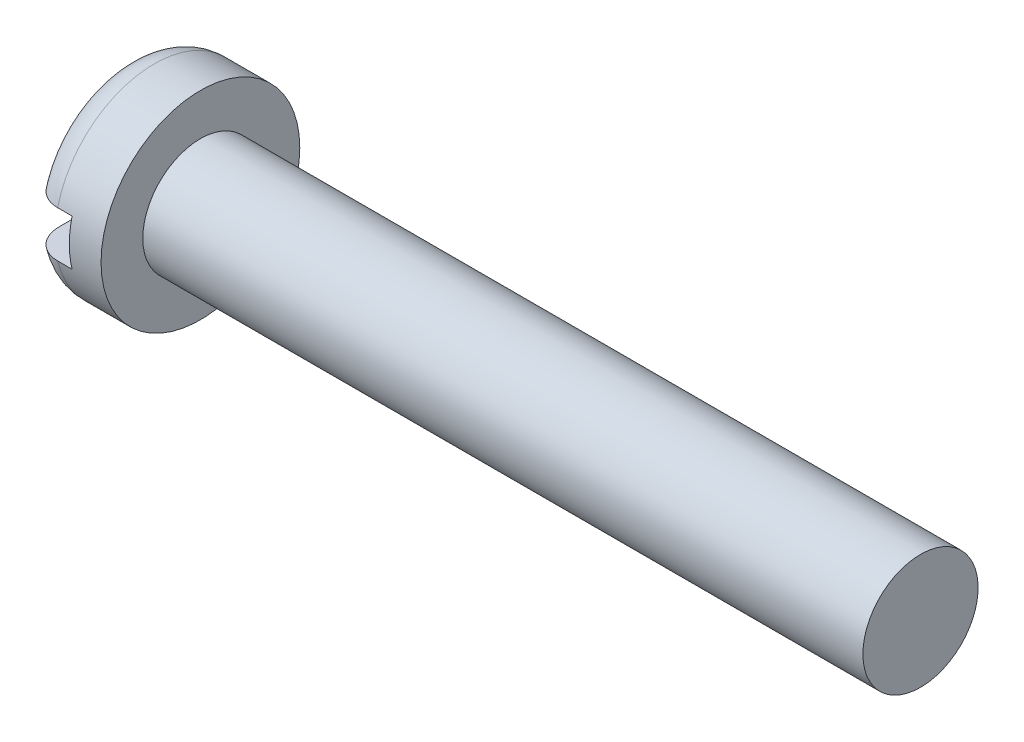
from build123d import *

# Parameters (mm, degrees)
SKETCH2_W  = 6.9
SKETCH2_H  = 1.6
SLOT_DEPTH = 1.5


with BuildPart() as part:
    # BodySke → Base-Revolve (revolve)
    with BuildSketch(Plane.XY):
        with BuildLine():
            Line((2.6, 2), (2.6, 3.45))
            Line((2.6, 3.45), (1, 3.45))
            ThreePointArc((1, 3.45), (0.292893219, 3.157106781), (0, 2.45))
            Line((0, 2.45), (0, 0))
            Line((0, 0), (27.6, 0))
            Line((27.6, 0), (27.6, 2))
            Line((27.6, 2), (2.6, 2))
        make_face()
    revolve(axis=Axis((-25.4, 0, 0), (1, 0, 0)))

    # Sketch2 → Slot (cut)
    with BuildSketch(Plane(origin=(0, 0, 0), x_dir=(0, 0, -1), z_dir=(1, 0, 0))):
        Rectangle(SKETCH2_W, SKETCH2_H)
    extrude(amount=SLOT_DEPTH, mode=Mode.SUBTRACT)


solid = part.part
